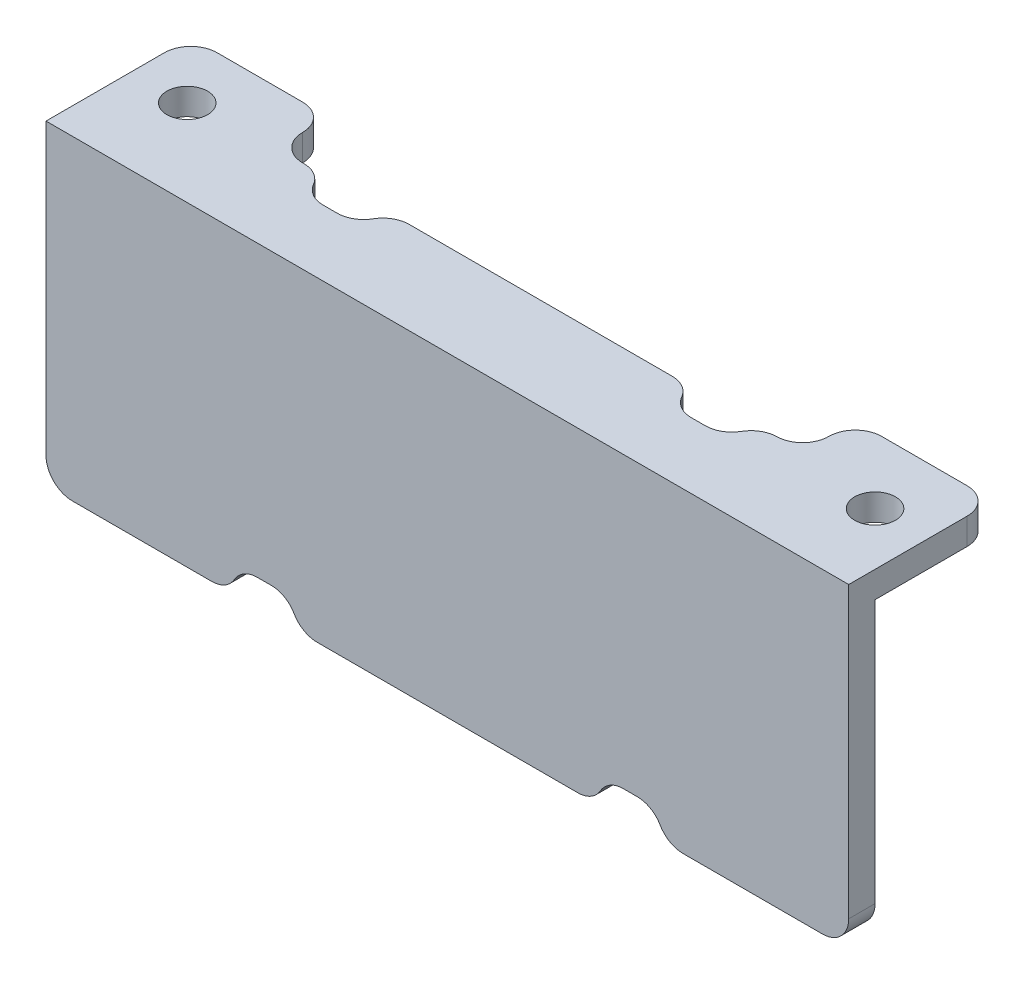
from build123d import *

# Parameters (mm, degrees)
BOSS_EXTRUDE1_DEPTH          = 48.41875
F_10_0_1935_DIAMETER_HOLE1_D = 4.9149
CUT_EXTRUDE3_REACH           = 65.246
SKETCH9_W                    = 63.5
SKETCH9_H                    = 6.35
CUT_EXTRUDE1_REACH           = 66.038
SKETCH7_W                    = 6.35
SKETCH7_H                    = 3.175
CUT_EXTRUDE2_REACH           = 65.246
SKETCH8_W                    = 6.35
SKETCH8_H                    = 3.175
FILLET1_R                    = 3.175
FILLET2_R                    = 3.175


with BuildPart() as part:
    # Sketch1 → Boss-Extrude1 (new, symmetric)
    with BuildSketch(Plane(origin=(0, 0, 0), x_dir=(0, 0, -1), z_dir=(1, 0, 0))):
        Polygon((0, 0), (-3.175, 0), (-3.175, 38.1), (14.2875, 38.1), (14.2875, 34.925), (0, 34.925), align=None)
    extrude(amount=BOSS_EXTRUDE1_DEPTH, both=True)

    # #10 (0.1935) Diameter Hole1 (through all)
    with Locations(Plane(origin=(0, 34.925, 0), x_dir=(-1, 0, 0), z_dir=(0, -1, 0))):
        with Locations((41.794904569, 7.239), (-42.06875, 6.35)):
            Hole(F_10_0_1935_DIAMETER_HOLE1_D / 2)

    # Sketch9 → Cut-Extrude3 (cut, up to next)
    with BuildSketch(Plane(origin=(0, 38.1, 0), x_dir=(1, 0, 0), z_dir=(0, 1, 0)), mode=Mode.PRIVATE) as cut_extrude3_sk1:
        with Locations((0, 11.1125)):
            Rectangle(SKETCH9_W, SKETCH9_H)
    cut_extrude3_tool1 = extrude(cut_extrude3_sk1.sketch, amount=-CUT_EXTRUDE3_REACH, mode=Mode.PRIVATE) & part.part
    add(cut_extrude3_tool1.solids().sort_by_distance((0, 38.1, -11.1125))[0], mode=Mode.SUBTRACT)

    # Sketch7 → Cut-Extrude1 (cut, up to next)
    with BuildSketch(Plane.XY.offset(3.175), mode=Mode.PRIVATE) as cut_extrude1_sk1:
        with Locations((-22.075650032, 1.5875)):
            Rectangle(SKETCH7_W, SKETCH7_H)
    cut_extrude1_tool1 = extrude(cut_extrude1_sk1.sketch, amount=-CUT_EXTRUDE1_REACH, mode=Mode.PRIVATE) & part.part
    # Sketch7 → Cut-Extrude1 (cut, up to next)
    with BuildSketch(Plane.XY.offset(3.175), mode=Mode.PRIVATE) as cut_extrude1_sk2:
        with Locations((22.075650032, 1.5875)):
            Rectangle(SKETCH7_W, SKETCH7_H)
    cut_extrude1_tool2 = extrude(cut_extrude1_sk2.sketch, amount=-CUT_EXTRUDE1_REACH, mode=Mode.PRIVATE) & part.part
    add(cut_extrude1_tool1.solids().sort_by_distance((-22.07565, 1.5875, 3.175))[0], mode=Mode.SUBTRACT)
    add(cut_extrude1_tool2.solids().sort_by_distance((22.07565, 1.5875, 3.175))[0], mode=Mode.SUBTRACT)

    # Sketch8 → Cut-Extrude2 (cut, up to next)
    with BuildSketch(Plane(origin=(0, 38.1, 0), x_dir=(1, 0, 0), z_dir=(0, 1, 0)), mode=Mode.PRIVATE) as cut_extrude2_sk1:
        with Locations((-22.071804601, 6.35)):
            Rectangle(SKETCH8_W, SKETCH8_H)
    cut_extrude2_tool1 = extrude(cut_extrude2_sk1.sketch, amount=-CUT_EXTRUDE2_REACH, mode=Mode.PRIVATE) & part.part
    # Sketch8 → Cut-Extrude2 (cut, up to next)
    with BuildSketch(Plane(origin=(0, 38.1, 0), x_dir=(1, 0, 0), z_dir=(0, 1, 0)), mode=Mode.PRIVATE) as cut_extrude2_sk2:
        with Locations((22.345650032, 6.35)):
            Rectangle(SKETCH8_W, SKETCH8_H)
    cut_extrude2_tool2 = extrude(cut_extrude2_sk2.sketch, amount=-CUT_EXTRUDE2_REACH, mode=Mode.PRIVATE) & part.part
    add(cut_extrude2_tool1.solids().sort_by_distance((-22.071805, 38.1, -6.35))[0], mode=Mode.SUBTRACT)
    add(cut_extrude2_tool2.solids().sort_by_distance((22.34565, 38.1, -6.35))[0], mode=Mode.SUBTRACT)

    # Fillet1
    fillet1_edges = [part.edges().sort_by_distance(p)[0] for p in [
        (25.250650032, 0, 1.5875),
        (18.900650032, 0, 1.5875),
        (-18.900650032, 0, 1.5875),
        (-25.250650032, 0, 1.5875),
        (48.41875, 36.5125, -14.2875),
        (-48.41875, 36.5125, -14.2875),
        (48.41875, 0, 1.5875),
        (-48.41875, 0, 1.5875),
        (25.520650032, 36.5125, -7.9375),
        (19.170650032, 36.5125, -7.9375),
        (-18.896804601, 36.5125, -7.9375),
        (-25.246804601, 36.5125, -7.9375),
        (31.75, 36.5125, -14.2875),
        (-31.75, 36.5125, -14.2875),
    ]]
    fillet(fillet1_edges, radius=FILLET1_R - 0.0001)  # a hair under: the kernel refuses the full size

    # Fillet2
    fillet2_edges = [part.edges().sort_by_distance(p)[0] for p in [
        (25.250650032, 3.175, 1.5875),
        (18.900650032, 3.175, 1.5875),
        (-18.900650032, 3.175, 1.5875),
        (-25.250650032, 3.175, 1.5875),
        (25.520650032, 36.5125, -4.7625),
        (19.170650032, 36.5125, -4.7625),
        (-18.896804601, 36.5125, -4.7625),
        (-25.246804601, 36.5125, -4.7625),
        (-31.75, 36.5125, -7.9375),
        (31.75, 36.5125, -7.9375),
    ]]
    fillet(fillet2_edges, radius=FILLET2_R)


solid = part.part
